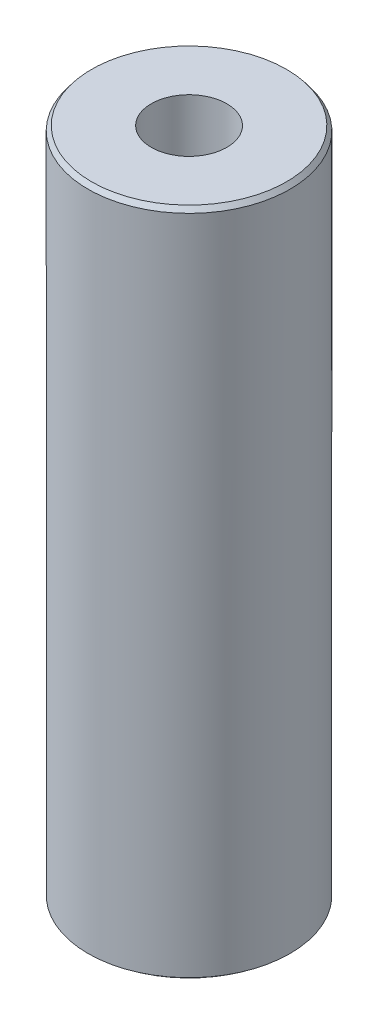
from build123d import *
from OCP.BRepFilletAPI import BRepFilletAPI_MakeChamfer

# Parameters (mm, degrees)
SKETCH1_R           = 45
BOSS_EXTRUDE1_DEPTH = 298.553097521
SKETCH2_R           = 16.847799044
CUT_EXTRUDE1_DEPTH  = 306.260465896
CHAMFER1_SIZE       = 2.071432357
CHAMFER1_SIZE2      = 1.578074523


with BuildPart() as part:
    # Sketch1 → Boss-Extrude1 (new body)
    with BuildSketch(Plane(origin=(0, 0, 0), x_dir=(1, 0, 0), z_dir=(0, 1, 0))):
        Circle(SKETCH1_R)
    extrude(amount=BOSS_EXTRUDE1_DEPTH)

    # Sketch2 → Cut-Extrude1 (cut, through all)
    with BuildSketch(Plane(origin=(0, 0, 0), x_dir=(1, 0, 0), z_dir=(0, 1, 0))):
        Circle(SKETCH2_R)
    extrude(amount=CUT_EXTRUDE1_DEPTH, mode=Mode.SUBTRACT)

    # Chamfer1: one chamfer whose edges measure the first distance from different faces: ONE call of the kernel's chamfer builder (chamfer() names one face for all edges)
    chamfer1_edges_1 = [part.edges().sort_by_distance(p)[0] for p in [
        (-45, 298.553097521, 0),
    ]]
    chamfer1_side_1 = [part.faces().sort_by_distance(p)[0] for p in [
        (-45, 149.27654876, 0),
    ]]
    chamfer1_edges_2 = [part.edges().sort_by_distance(p)[0] for p in [
        (-45, 0, 0),
    ]]
    chamfer1_side_2 = [part.faces().sort_by_distance(p)[0] for p in [
        (-43.727207794, 0, 0),
    ]]
    chamfer1 = BRepFilletAPI_MakeChamfer(part.part.solid().wrapped)
    for e in chamfer1_edges_1:
        chamfer1.Add(CHAMFER1_SIZE, CHAMFER1_SIZE2, e.wrapped, chamfer1_side_1[0].wrapped)  # the first distance lies on this face
    for e in chamfer1_edges_2:
        chamfer1.Add(CHAMFER1_SIZE, CHAMFER1_SIZE2, e.wrapped, chamfer1_side_2[0].wrapped)  # the first distance lies on this face
    add(Compound.cast(chamfer1.Shape()), mode=Mode.REPLACE)


solid = part.part
